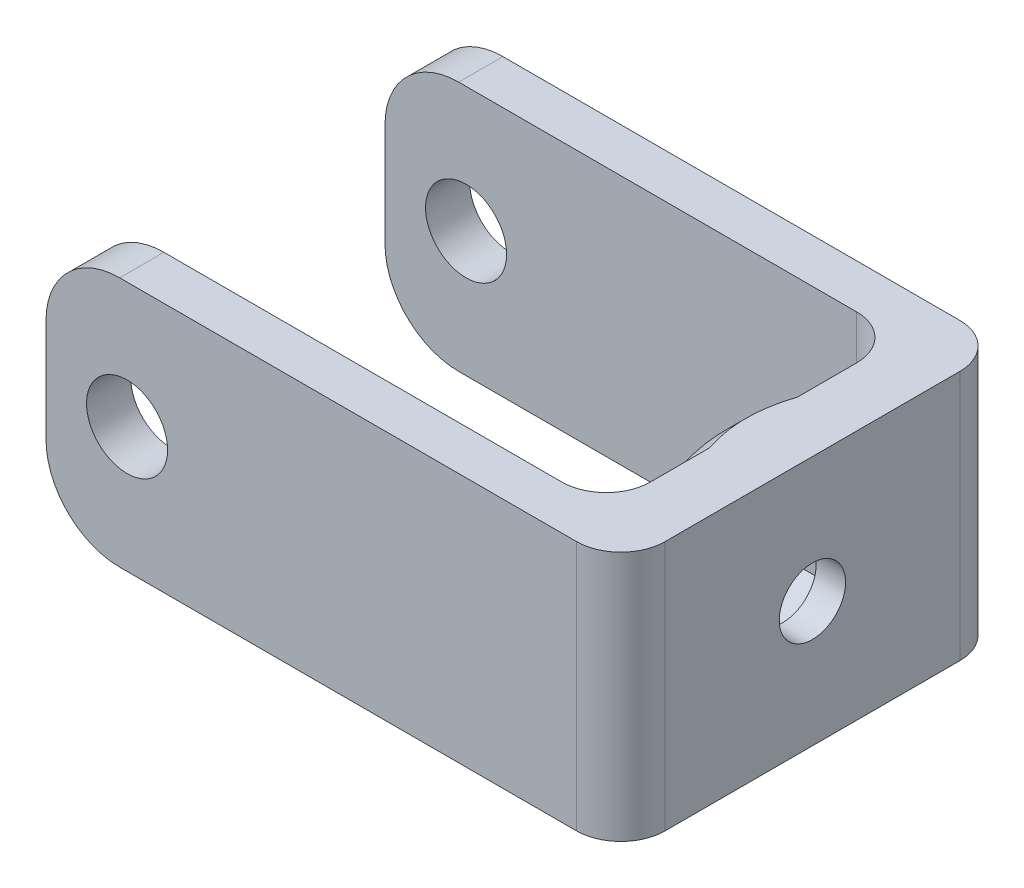
from build123d import *

# Parameters (mm, degrees)
SKETCH1_W           = 26
SKETCH1_H           = 17
BOSS_EXTRUDE1_DEPTH = 4
SKETCH2_W           = 3
SKETCH2_H           = 17
BOSS_EXTRUDE2_DEPTH = 35
SKETCH3_R           = 2.75
CUT_EXTRUDE1_DEPTH  = 45.421278685
FILLET1_R           = 3
FILLET2_R           = 5
SKETCH5_R           = 7
BOSS_EXTRUDE3_DEPTH = 2
CUT_EXTRUDE3_REACH  = 43.979
SKETCH7_R           = 2.25
CUT_EXTRUDE4_DEPTH  = 4
CHAMFER1_SIZE       = 2


with BuildPart() as part:
    # Sketch1 → Boss-Extrude1 (new body)
    with BuildSketch(Plane(origin=(0, 0, 0), x_dir=(0, 0, -1), z_dir=(1, 0, 0))):
        Rectangle(SKETCH1_W, SKETCH1_H)
    extrude(amount=BOSS_EXTRUDE1_DEPTH)

    # Sketch2 → Boss-Extrude2 (add)
    with BuildSketch(Plane.ZY):
        with Locations((-11.5, 0)):
            Rectangle(SKETCH2_W, SKETCH2_H)
        with Locations((11.5, 0)):
            Rectangle(SKETCH2_W, SKETCH2_H)
    extrude(amount=BOSS_EXTRUDE2_DEPTH)

    # Sketch3 → Cut-Extrude1 (cut, through all)
    with BuildSketch(Plane.XY.offset(13)):
        with Locations((-29.5, 0)):
            Circle(SKETCH3_R)
    extrude(amount=-CUT_EXTRUDE1_DEPTH, mode=Mode.SUBTRACT)

    # Fillet1
    fillet1_edges = [part.edges().sort_by_distance(p)[0] for p in [
        (4, 0, 13),
        (0, 0, -10),
        (0, 0, 10),
        (4, 0, -13),
    ]]
    fillet(fillet1_edges, radius=FILLET1_R)

    # Fillet2
    fillet2_edges = [part.edges().sort_by_distance(p)[0] for p in [
        (-35, -8.5, -11.5),
        (-35, 8.5, -11.5),
        (-35, 8.5, 11.5),
        (-35, -8.5, 11.5),
    ]]
    fillet(fillet2_edges, radius=FILLET2_R)

    # Sketch5 → Boss-Extrude3 (add)
    with BuildSketch(Plane.ZY):
        Circle(SKETCH5_R)
    extrude(amount=BOSS_EXTRUDE3_DEPTH)

    # Sketch7 → Cut-Extrude3 (cut, up to next)
    with BuildSketch(Plane(origin=(4, 0, 0), x_dir=(0, 0, -1), z_dir=(1, 0, 0)), mode=Mode.PRIVATE) as cut_extrude3_sk1:
        Circle(SKETCH7_R)
    cut_extrude3_tool1 = extrude(cut_extrude3_sk1.sketch, amount=-CUT_EXTRUDE3_REACH, mode=Mode.PRIVATE) & part.part
    add(cut_extrude3_tool1.solids().sort_by_distance((4, 0, 0))[0], mode=Mode.SUBTRACT)

    # Sketch8 → Cut-Extrude4 (cut)
    with BuildSketch(Plane.ZY.offset(2)):
        Polygon((0, 4.330127019), (-3.75, 2.165063509), (-3.75, -2.165063509), (0, -4.330127019), (3.75, -2.165063509), (3.75, 2.165063509), align=None)
    extrude(amount=-CUT_EXTRUDE4_DEPTH, mode=Mode.SUBTRACT)

    # Chamfer1
    # the kernel refuses this chamfer: 2 mm, written as the material it adds along each edge
    with BuildSketch(Plane(origin=(0, 0, 0), x_dir=(0, 0, 1), z_dir=(0, -1, 0))) as chamfer1_piece_1_section:
        Polygon((7 + CHAMFER1_SIZE, 0), (7, CHAMFER1_SIZE), (7, 0), align=None)
    chamfer1_piece_1 = revolve(axis=Axis((0, 0, 0), (-1, 0, 0)), revolution_arc=180, mode=Mode.PRIVATE)
    chamfer1_piece_1 = split(chamfer1_piece_1, bisect_by=Plane(origin=(-0.945270908, 8.5, 0), z_dir=(0, -1, 0)), keep=Keep.TOP, mode=Mode.PRIVATE)
    chamfer1_piece_1 = split(chamfer1_piece_1, bisect_by=Plane(origin=(-2, 8.001839451, 0), z_dir=(1, 0, 0)), keep=Keep.TOP, mode=Mode.PRIVATE)
    add(chamfer1_piece_1)
    with BuildSketch(Plane(origin=(0, 0, 0), x_dir=(0, 0, -1), z_dir=(0, 1, 0))) as chamfer1_piece_2_section:
        Polygon((7 + CHAMFER1_SIZE, 0), (7, CHAMFER1_SIZE), (7, 0), align=None)
    chamfer1_piece_2 = revolve(axis=Axis((0, 0, 0), (-1, 0, 0)), revolution_arc=180, mode=Mode.PRIVATE)
    chamfer1_piece_2 = split(chamfer1_piece_2, bisect_by=Plane(origin=(-0.945270905, -8.5, 0), z_dir=(0, 1, 0)), keep=Keep.TOP, mode=Mode.PRIVATE)
    chamfer1_piece_2 = split(chamfer1_piece_2, bisect_by=Plane(origin=(-2, -8.001839447, 0), z_dir=(1, 0, 0)), keep=Keep.TOP, mode=Mode.PRIVATE)
    add(chamfer1_piece_2)


solid = part.part
